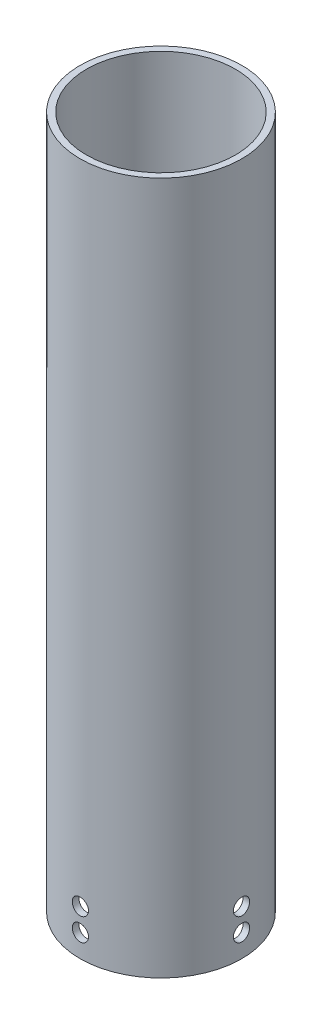
from build123d import *

# Parameters (mm, degrees)
SKETCH_1_R               = 25
SKETCH_1_R_2             = 23
EXTRUDE_1_DEPTH          = 214
SKETCH_2_R               = 2.5
CUT_EXTRUDE_1_DEPTH      = 217.90089903
PATTERN_CIRCULAR_1_COUNT = 2
PATTERN_CIRCULAR_1_ANGLE = 90


with BuildPart() as part:
    # Эскиз1 → Бобышка-Вытянуть1 (new body)
    with BuildSketch(Plane(origin=(0, 0, 0), x_dir=(1, 0, 0), z_dir=(0, 1, 0))):
        Circle(SKETCH_1_R)
        Circle(SKETCH_1_R_2, mode=Mode.SUBTRACT)
    extrude(amount=EXTRUDE_1_DEPTH)

    # Эскиз2 → Вырез-Вытянуть1 (cut, symmetric)
    with BuildSketch(Plane.XY):
        with Locations((0, 7)):
            Circle(SKETCH_2_R)
        with Locations((0, 14)):
            Circle(SKETCH_2_R)
    cut_extrude_1 = extrude(amount=CUT_EXTRUDE_1_DEPTH, both=True, mode=Mode.SUBTRACT)

    # Круговой массив1: Вырез-Вытянуть1 ×2 about axis
    pattern_circular_1_axis = Axis((0, 214, 0), (0, 1, 0))
    for i in range(1, PATTERN_CIRCULAR_1_COUNT):
        add(cut_extrude_1.rotate(pattern_circular_1_axis, i * PATTERN_CIRCULAR_1_ANGLE / (PATTERN_CIRCULAR_1_COUNT - 1)), mode=Mode.SUBTRACT)


solid = part.part
